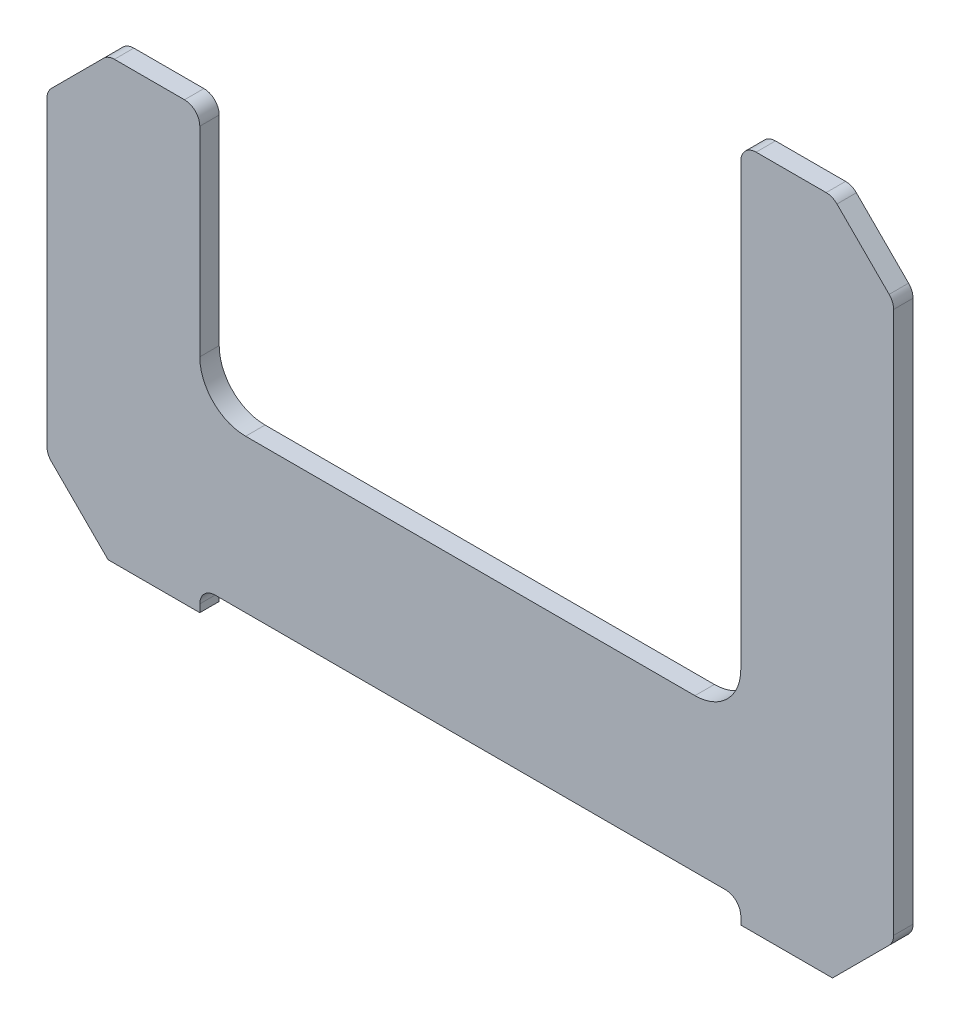
from build123d import *

# Parameters (mm, degrees)
BOSS_EXTRUDE1_DEPTH      = 3.175
BOSS_EXTRUDE1_DEPTH_BACK = 3.175
CHAMFER1_SIZE            = 20
FILLET1_R                = 15
FILLET2_R                = 5


with BuildPart() as part:
    # Sketch2 → Boss-Extrude1 (new, two sides: drawn at the far end of the back side and taken through both)
    with BuildSketch(Plane.XY.offset(-BOSS_EXTRUDE1_DEPTH_BACK)):
        Polygon((-138.5, 85.338455572), (-88.5, 85.338455572), (-88.5, 0), (88.5, 0), (88.5, 164), (138.5, 164), (138.5, -57.5), (88.5, -57.5), (88.5, -50), (-88.5, -50), (-88.5, -57.5), (-138.5, -57.5), align=None)
    extrude(amount=BOSS_EXTRUDE1_DEPTH + BOSS_EXTRUDE1_DEPTH_BACK)

    # Chamfer1
    chamfer1_edges = [part.edges().sort_by_distance(p)[0] for p in [
        (-138.5, -57.5, 0),
        (138.5, -57.5, 0),
        (138.5, 164, 0),
        (-138.5, 85.338455572, 0),
    ]]
    chamfer(chamfer1_edges, length=CHAMFER1_SIZE)

    # Fillet1
    fillet1_edges = [part.edges().sort_by_distance(p)[0] for p in [
        (88.5, 0, 0),
        (-88.5, 0, 0),
    ]]
    fillet(fillet1_edges, radius=FILLET1_R)

    # Fillet2
    fillet2_edges = [part.edges().sort_by_distance(p)[0] for p in [
        (138.5, -37.5, 0),
        (88.5, -50, 0),
        (-88.5, -50, 0),
        (-138.5, -37.5, 0),
        (-138.5, 65.338455572, 0),
        (-118.5, 85.338455572, 0),
        (-88.5, 85.338455572, 0),
        (138.5, 144, 0),
        (118.5, 164, 0),
        (88.5, 164, 0),
    ]]
    fillet(fillet2_edges, radius=FILLET2_R)


solid = part.part
